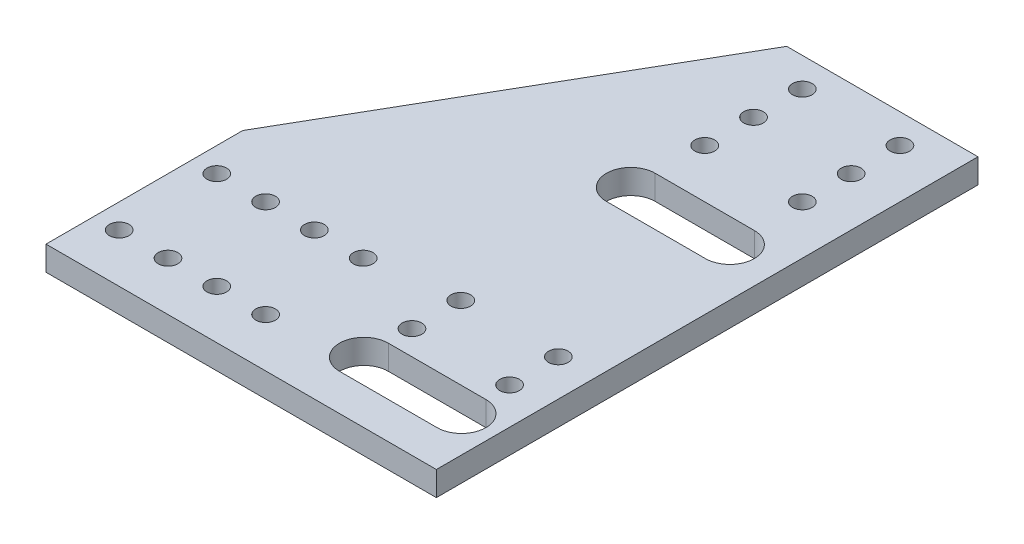
from build123d import *

# Parameters (mm, degrees)
SKETCH1_W               = 101.6
SKETCH1_H               = 152.4
BOSS_EXTRUDE1_DEPTH     = 6.35
SKETCH2_R               = 2.5527
CUT_EXTRUDE1_DEPTH      = 184.272045059
CUT_EXTRUDE2_DEPTH      = 184.272045059
SKETCH4_R               = 2.5527
CUT_EXTRUDE3_DEPTH      = 184.272045059
CUT_EXTRUDE4_DEPTH      = 184.272045059
SKETCH6_R               = 2.5527
CUT_EXTRUDE5_DEPTH      = 184.272045059
CUT_EXTRUDE6_DEPTH      = 184.272045059
CUT_EXTRUDE6_DEPTH_BACK = 184.272045059
CUT_EXTRUDE7_DEPTH      = 184.272045059


with BuildPart() as part:
    # Sketch1 → Boss-Extrude1 (new body)
    with BuildSketch(Plane(origin=(0, 0, 0), x_dir=(1, 0, 0), z_dir=(0, 1, 0))):
        with Locations((50.8, 76.2)):
            Rectangle(SKETCH1_W, SKETCH1_H)
    extrude(amount=BOSS_EXTRUDE1_DEPTH)

    # Sketch2 → Cut-Extrude1 (cut, through all)
    with BuildSketch(Plane(origin=(0, 0, 0), x_dir=(-1, 0, 0), z_dir=(0, -1, 0))):
        with Locations((-88.9, 146.05)):
            Circle(SKETCH2_R)
        with Locations((-88.9, 133.35)):
            Circle(SKETCH2_R)
        with Locations((-88.9, 120.65)):
            Circle(SKETCH2_R)
        with Locations((-88.9, 107.95)):
            Circle(SKETCH2_R)
        with Locations((-63.5, 133.35)):
            Circle(SKETCH2_R)
        with Locations((-63.5, 120.65)):
            Circle(SKETCH2_R)
        with Locations((-63.5, 107.95)):
            Circle(SKETCH2_R)
        with Locations((-63.5, 146.05)):
            Circle(SKETCH2_R)
    extrude(amount=-CUT_EXTRUDE1_DEPTH, mode=Mode.SUBTRACT)

    # Sketch3 → Cut-Extrude2 (cut, through all)
    with BuildSketch(Plane(origin=(0, 0, 0), x_dir=(-1, 0, 0), z_dir=(0, -1, 0))):
        with BuildLine():
            Line((-89.0905, 95.25), (-63.3095, 95.25))
            ThreePointArc((-63.3095, 95.25), (-56.9595, 88.9), (-63.3095, 82.55))
            Line((-63.3095, 82.55), (-89.0905, 82.55))
            ThreePointArc((-89.0905, 82.55), (-95.4405, 88.9), (-89.0905, 95.25))
        make_face()
    extrude(amount=-CUT_EXTRUDE2_DEPTH, mode=Mode.SUBTRACT)

    # Sketch4 → Cut-Extrude3 (cut, through all)
    with BuildSketch(Plane(origin=(0, 0, 0), x_dir=(-1, 0, 0), z_dir=(0, -1, 0))):
        with Locations((-92.075, 41.275)):
            Circle(SKETCH4_R)
        with Locations((-66.675, 41.275)):
            Circle(SKETCH4_R)
        with Locations((-66.675, 28.575)):
            Circle(SKETCH4_R)
        with Locations((-92.075, 28.575)):
            Circle(SKETCH4_R)
    extrude(amount=-CUT_EXTRUDE3_DEPTH, mode=Mode.SUBTRACT)

    # Sketch5 → Cut-Extrude4 (cut, through all)
    with BuildSketch(Plane(origin=(0, 0, 0), x_dir=(-1, 0, 0), z_dir=(0, -1, 0))):
        with BuildLine():
            Line((-92.2655, 22.225), (-66.8655, 22.225))
            ThreePointArc((-66.8655, 22.225), (-60.5155, 15.875), (-66.8655, 9.525))
            Line((-66.8655, 9.525), (-92.2655, 9.525))
            ThreePointArc((-92.2655, 9.525), (-98.6155, 15.875), (-92.2655, 22.225))
        make_face()
    extrude(amount=-CUT_EXTRUDE4_DEPTH, mode=Mode.SUBTRACT)

    # Sketch6 → Cut-Extrude5 (cut, through all)
    with BuildSketch(Plane(origin=(0, 0, 0), x_dir=(-1, 0, 0), z_dir=(0, -1, 0))):
        with Locations((-44.45, 38.1)):
            Circle(SKETCH6_R)
        with Locations((-31.75, 38.1)):
            Circle(SKETCH6_R)
        with Locations((-19.05, 38.1)):
            Circle(SKETCH6_R)
        with Locations((-31.75, 12.7)):
            Circle(SKETCH6_R)
        with Locations((-19.05, 12.7)):
            Circle(SKETCH6_R)
        with Locations((-44.45, 12.7)):
            Circle(SKETCH6_R)
        with Locations((-6.35, 38.1)):
            Circle(SKETCH6_R)
        with Locations((-6.35, 12.7)):
            Circle(SKETCH6_R)
    extrude(amount=-CUT_EXTRUDE5_DEPTH, mode=Mode.SUBTRACT)

    # Sketch7 → Cut-Extrude6 (cut, two sides: drawn at the far end of the back side and taken through both)
    with BuildSketch(Plane(origin=(0, 0, 0), x_dir=(-1, 0, 0), z_dir=(0, -1, 0)).offset(-CUT_EXTRUDE6_DEPTH_BACK)):
        Polygon((-58.42, 152.4), (0, 152.4), (0, 51.213591822), align=None)
    extrude(amount=CUT_EXTRUDE6_DEPTH + CUT_EXTRUDE6_DEPTH_BACK, mode=Mode.SUBTRACT)

    # Sketch8 → Cut-Extrude7 (cut, through all)
    with BuildSketch(Plane(origin=(0, 0, 0), x_dir=(-1, 0, 0), z_dir=(0, -1, 0))):
        Polygon((-101.6, 152.4), (-58.42, 152.4), (-51.820886423, 140.97), (-101.6, 140.97), align=None)
    extrude(amount=-CUT_EXTRUDE7_DEPTH, mode=Mode.SUBTRACT)


solid = part.part
